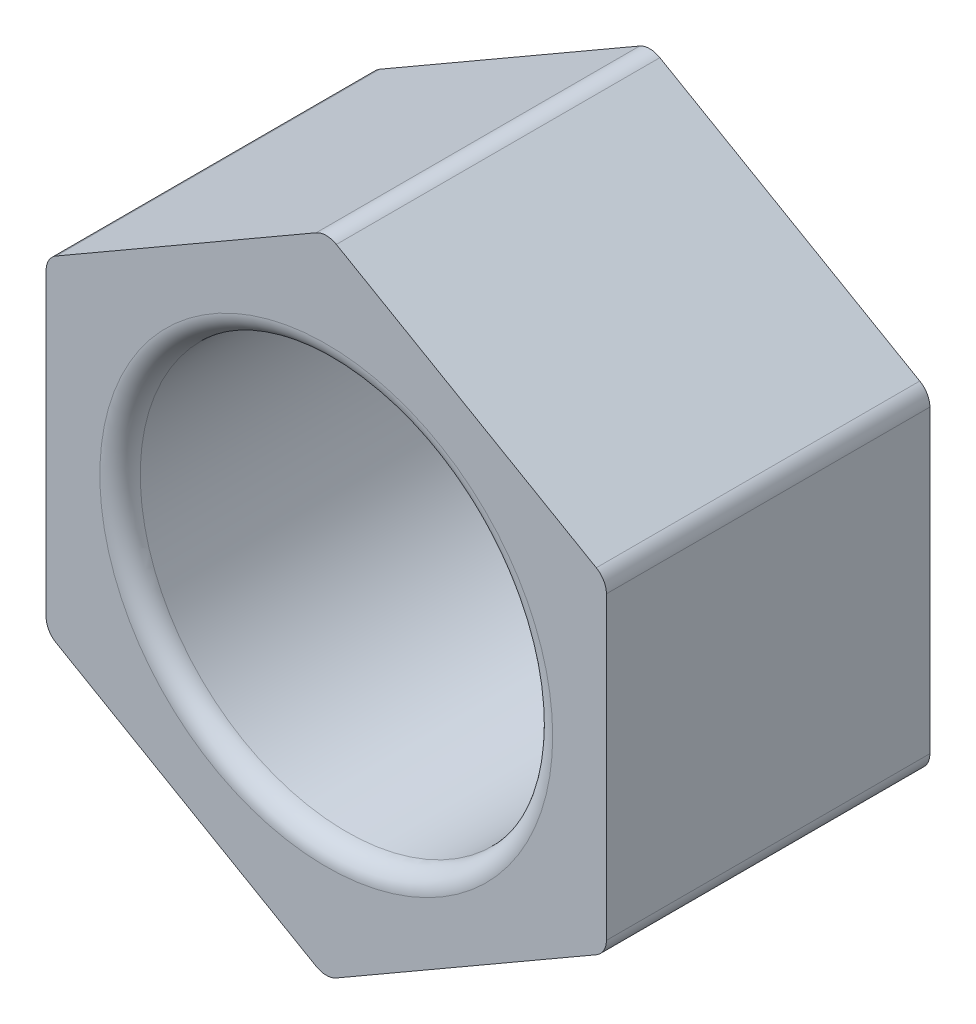
from build123d import *

# Parameters (mm, degrees)
BOSS_EXTRUDE1_DEPTH = 4
SKETCH2_R           = 2.55
CUT_EXTRUDE1_DEPTH  = 7.633249581
FILLET1_R           = 0.25


with BuildPart() as part:
    # Sketch1 → Boss-Extrude1 (new body)
    with BuildSketch(Plane.XY):
        Polygon((0, 4), (-3.464101615, 2), (-3.464101615, -2), (0, -4), (3.464101615, -2), (3.464101615, 2), align=None)
    extrude(amount=BOSS_EXTRUDE1_DEPTH)

    # Sketch2 → Cut-Extrude1 (cut, through all)
    with BuildSketch(Plane.XY.offset(4)):
        Circle(SKETCH2_R)
    extrude(amount=-CUT_EXTRUDE1_DEPTH, mode=Mode.SUBTRACT)

    # Fillet1
    fillet1_edges = [part.edges().sort_by_distance(p)[0] for p in [
        (-2.55, 0, 4),
        (-2.55, 0, 0),
        (-3.464101615, 2, 2),
        (-3.464101615, -2, 2),
        (0, -4, 2),
        (3.464101615, -2, 2),
        (3.464101615, 2, 2),
        (0, 4, 2),
    ]]
    fillet(fillet1_edges, radius=FILLET1_R)


solid = part.part
